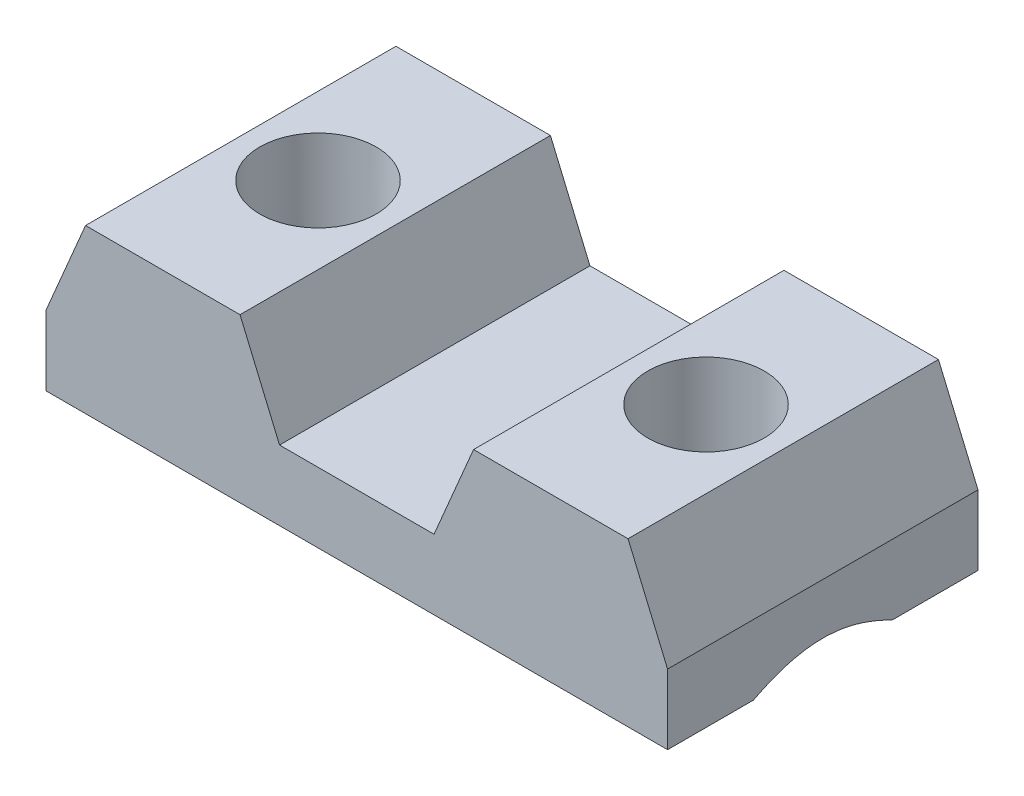
from build123d import *

# Parameters (mm, degrees)
EXTRUDE_1_DEPTH     = 8
SKETCH_2_R          = 1.5
CUT_EXTRUDE_1_DEPTH = 13.074353161
CHAMFER_1_SIZE      = 2


with BuildPart() as part:
    # ｽｹｯﾁ1 → ﾎﾞｽ - 押し出し1 (new body)
    with BuildSketch(Plane.XY):
        Polygon((-6.990630221, 0), (-3.009369779, 0), (-1.990630221, -2.4), (1.990630221, -2.4), (3.009369779, 0), (6.990630221, 0), (8.009369779, -2.4), (8.009369779, -4.2), (-8.009369779, -4.2), (-8.009369779, -2.4), align=None)
    extrude(amount=EXTRUDE_1_DEPTH)

    # ｽｹｯﾁ2 → ｶｯﾄ - 押し出し1 (cut, through all)
    with BuildSketch(Plane(origin=(0, 0, 0), x_dir=(1, 0, 0), z_dir=(0, 1, 0))):
        with Locations(Location((-5, -4, 0), (0, 0, 180))):
            Circle(SKETCH_2_R)
        with Locations(Location((5, -4, 0), (0, 0, 180))):
            Circle(SKETCH_2_R)
    extrude(amount=-CUT_EXTRUDE_1_DEPTH, mode=Mode.SUBTRACT)

    # 面取り1
    # the kernel refuses this chamfer: 2 mm, written as the material it takes off along each edge
    with BuildSketch(Plane(origin=(-5, -4.2, 4), x_dir=(-1, 0, 0), z_dir=(0, 0, -1))) as chamfer_1_piece_1:
        Polygon((1.5, CHAMFER_1_SIZE), (1.5 + CHAMFER_1_SIZE, 0), (1.5, 0), align=None)
    revolve(axis=Axis((-5, -4.2, 4), (0, 1, 0)), mode=Mode.SUBTRACT)
    with BuildSketch(Plane(origin=(5, -4.2, 4), x_dir=(-1, 0, 0), z_dir=(0, 0, -1))) as chamfer_1_piece_2:
        Polygon((1.5 + CHAMFER_1_SIZE, 0), (1.5, CHAMFER_1_SIZE), (1.5, 0), align=None)
    revolve(axis=Axis((5, -4.2, 4), (0, 1, 0)), mode=Mode.SUBTRACT)


solid = part.part
